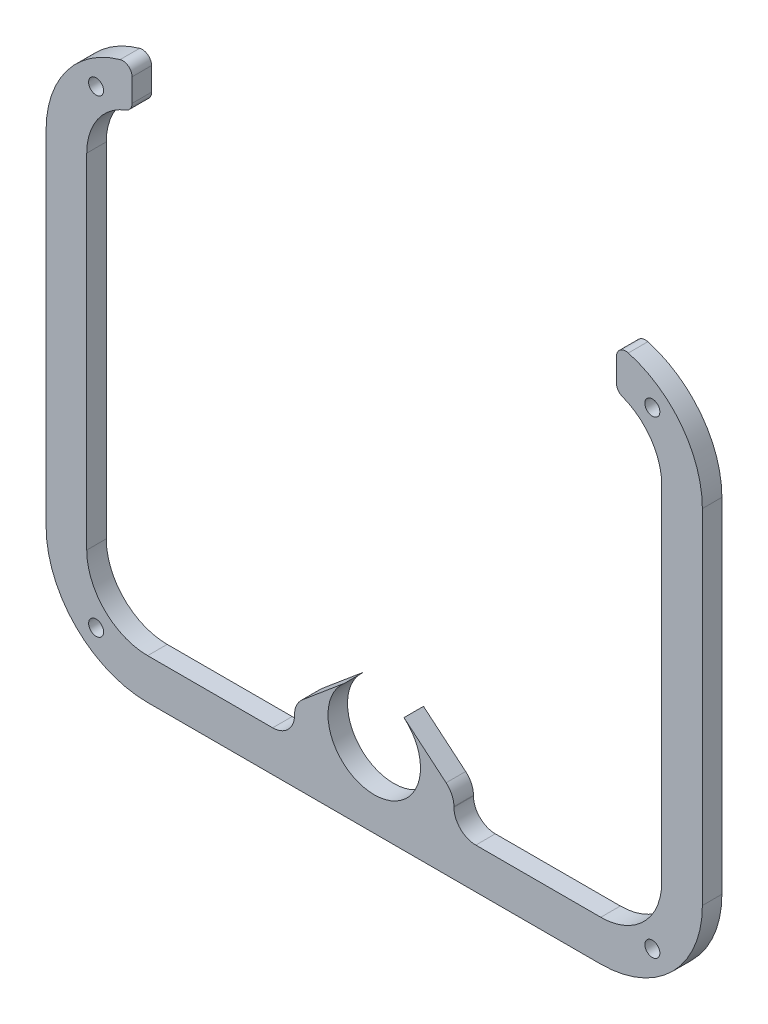
from build123d import *

# Parameters (mm, degrees)
SKETCH1_R           = 0.6096
BOSS_EXTRUDE1_DEPTH = 1.5875
CUT_EXTRUDE1_REACH  = 36.753
SKETCH2_W           = 3.155094666
SKETCH2_H           = 2.647438771
FILLET1_R           = 1.778
FILLET2_R           = 0.762


with BuildPart() as part:
    # Sketch1 → Boss-Extrude1 (new body)
    with BuildSketch(Plane.XY):
        with BuildLine():
            ThreePointArc((26.67, 13.97), (24.252166479, 19.807166479), (18.415, 22.225))
            Line((18.415, 22.225), (-18.415, 22.225))
            ThreePointArc((-18.415, 22.225), (-24.252166479, 19.807166479), (-26.67, 13.97))
            Line((-26.67, 13.97), (-26.67, -13.97))
            ThreePointArc((-26.67, -13.97), (-24.252166479, -19.807166479), (-18.415, -22.225))
            Line((-18.415, -22.225), (18.415, -22.225))
            ThreePointArc((18.415, -22.225), (24.252166479, -19.807166479), (26.67, -13.97))
            Line((26.67, -13.97), (26.67, 13.97))
        make_face()
        with Locations((-22.606, -19.05)):
            Circle(SKETCH1_R, mode=Mode.SUBTRACT)
        with BuildLine():
            Line((-9.632094666, -18.923), (-18.415, -18.923))
            ThreePointArc((-18.415, -18.923), (-21.917299887, -17.472299887), (-23.368, -13.97))
            Line((-23.368, -13.97), (-23.368, -1.27))
            Line((-23.368, -1.27), (-23.368, 0))
            Line((-23.368, 0), (-23.368, 13.97))
            ThreePointArc((-23.368, 13.97), (-21.917299887, 17.472299887), (-18.415, 18.923))
            Line((-18.415, 18.923), (18.415, 18.923))
            ThreePointArc((18.415, 18.923), (21.917299887, 17.472299887), (23.368, 13.97))
            Line((23.368, 13.97), (23.368, -13.97))
            ThreePointArc((23.368, -13.97), (21.917299887, -17.472299887), (18.415, -18.923))
            Line((18.415, -18.923), (9.632094666, -18.923))
            Line((9.632094666, -18.923), (2.416367182, -12.868285729))
            ThreePointArc((2.416367182, -12.868285729), (0, -19.5072), (-2.416367182, -12.868285729))
            Line((-2.416367182, -12.868285729), (-9.632094666, -18.923))
        make_face(mode=Mode.SUBTRACT)
        with Locations((22.606, -19.05)):
            Circle(SKETCH1_R, mode=Mode.SUBTRACT)
        with Locations((-22.606, 19.05)):
            Circle(SKETCH1_R, mode=Mode.SUBTRACT)
        with Locations((22.606, 19.05)):
            Circle(SKETCH1_R, mode=Mode.SUBTRACT)
    extrude(amount=BOSS_EXTRUDE1_DEPTH)

    # Sketch2 → Cut-Extrude1 (cut, up to next)
    with BuildSketch(Plane.XY.offset(1.5875), mode=Mode.PRIVATE) as cut_extrude1_sk1:
        with Locations((-8.054547333, -17.599280615)):
            Rectangle(SKETCH2_W, SKETCH2_H)
    cut_extrude1_tool1 = extrude(cut_extrude1_sk1.sketch, amount=-CUT_EXTRUDE1_REACH, mode=Mode.PRIVATE) & part.part
    # Sketch2 → Cut-Extrude1 (cut, up to next)
    with BuildSketch(Plane.XY.offset(1.5875), mode=Mode.PRIVATE) as cut_extrude1_sk2:
        with Locations((8.054547333, -17.599280615)):
            Rectangle(SKETCH2_W, SKETCH2_H)
    cut_extrude1_tool2 = extrude(cut_extrude1_sk2.sketch, amount=-CUT_EXTRUDE1_REACH, mode=Mode.PRIVATE) & part.part
    # Sketch2 → Cut-Extrude1 (cut, up to next)
    with BuildSketch(Plane.XY.offset(1.5875), mode=Mode.PRIVATE) as cut_extrude1_sk3:
        with BuildLine():
            Line((-18.415, 18.923), (18.415, 18.923))
            ThreePointArc((18.415, 18.923), (19.055374802, 18.881428419), (19.685, 18.757411514))
            Line((19.685, 18.757411514), (19.685, 22.225))
            Line((19.685, 22.225), (-19.685, 22.225))
            Line((-19.685, 22.225), (-19.685, 18.757411514))
            ThreePointArc((-19.685, 18.757411514), (-19.055374802, 18.881428419), (-18.415, 18.923))
        make_face()
    cut_extrude1_tool3 = extrude(cut_extrude1_sk3.sketch, amount=-CUT_EXTRUDE1_REACH, mode=Mode.PRIVATE) & part.part
    add(cut_extrude1_tool1.solids().sort_by_distance((-8.054547, -17.599281, 1.5875))[0], mode=Mode.SUBTRACT)
    add(cut_extrude1_tool2.solids().sort_by_distance((8.054547, -17.599281, 1.5875))[0], mode=Mode.SUBTRACT)
    add(cut_extrude1_tool3.solids().sort_by_distance((0, 20.57218, 1.5875))[0], mode=Mode.SUBTRACT)

    # Fillet1
    fillet1_edges = [part.edges().sort_by_distance(p)[0] for p in [
        (6.477, -18.923, 0.79375),
        (6.477, -16.275561229, 0.79375),
        (-6.477, -18.923, 0.79375),
        (-6.477, -16.275561229, 0.79375),
    ]]
    fillet(fillet1_edges, radius=FILLET1_R)

    # Fillet2
    fillet2_edges = [part.edges().sort_by_distance(p)[0] for p in [
        (19.685, 22.126722687, 0.79375),
        (19.685, 18.757411514, 0.79375),
        (-19.685, 18.757411514, 0.79375),
        (-19.685, 22.126722687, 0.79375),
    ]]
    fillet(fillet2_edges, radius=FILLET2_R)


solid = part.part
